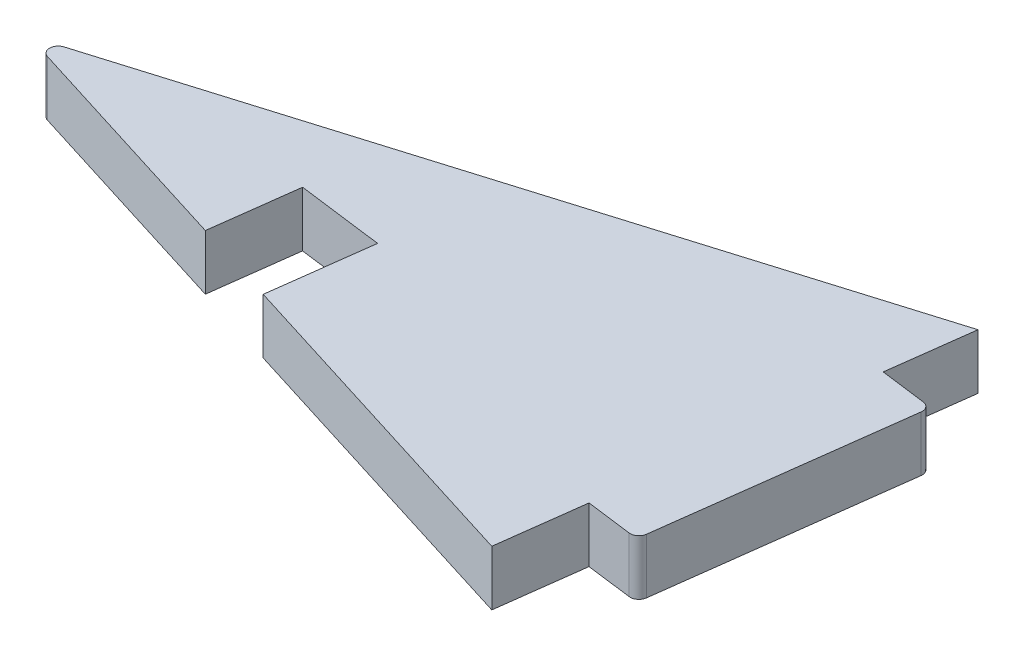
from build123d import *

# Parameters (mm, degrees)
BOSS_EXTRUDE1_DEPTH = 6.35
FILLET1_R           = 1


with BuildPart() as part:
    # Sketch1 → Boss-Extrude1 (new body)
    with BuildSketch(Plane(origin=(0, 0, 0), x_dir=(1, 0, 0), z_dir=(0, 1, 0))):
        Polygon((-2.58662904, -0.182978259), (-1.306630871, 9.734763655), (4.991135245, 8.921964817), (8.862776708, 38.921964817), (2.565209371, 39.734738), (3.813361808, 49.405731314), (-80.122978657, 24.047130996), (-50.562245366, 14.809401842), (-49.282247196, 24.727143757), (-39.364505281, 23.447145587), (-40.870201664, 11.780638185), align=None)
    extrude(amount=BOSS_EXTRUDE1_DEPTH)

    # Fillet1
    fillet1_edges = [part.edges().sort_by_distance(p)[0] for p in [
        (4.991135245, 3.175, -8.921964817),
        (8.862776708, 3.175, -38.921964817),
        (-80.122978657, 3.175, -24.047130996),
    ]]
    fillet(fillet1_edges, radius=FILLET1_R)


solid = part.part
